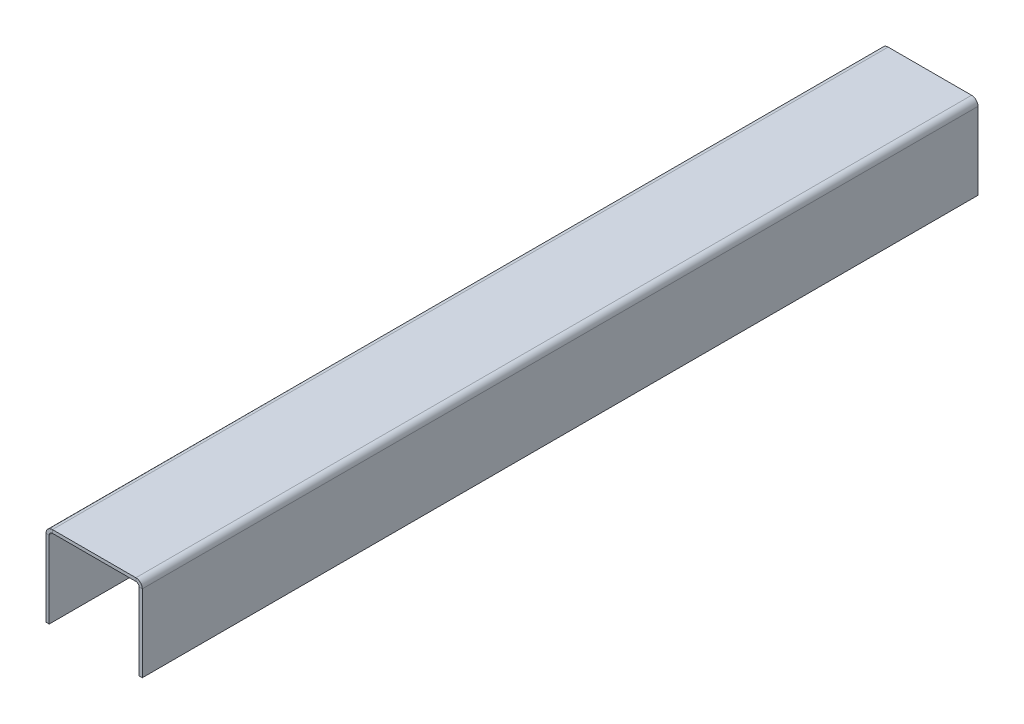
from build123d import *

# Parameters (mm, degrees)
BASE_FLANGE1_DEPTH = 826.77


# Sheet-metal steps are written as plain solids
with BuildPart() as part:
    # Sketch1 → Base-Flange1 (new body)
    with BuildSketch(Plane.XY):
        with BuildLine():
            Line((0, 0), (0, 76.2))
            ThreePointArc((0, 76.2), (1.859871939, 80.690128061), (6.35, 82.55))
            Line((6.35, 82.55), (88.9, 82.55))
            ThreePointArc((88.9, 82.55), (93.390128061, 80.690128061), (95.25, 76.2))
            Line((95.25, 76.2), (95.25, 0))
            Line((95.25, 0), (92.075, 0))
            Line((92.075, 0), (92.075, 76.2))
            ThreePointArc((92.075, 76.2), (91.14506403, 78.44506403), (88.9, 79.375))
            Line((88.9, 79.375), (6.35, 79.375))
            ThreePointArc((6.35, 79.375), (4.10493597, 78.44506403), (3.175, 76.2))
            Line((3.175, 76.2), (3.175, 0))
            Line((3.175, 0), (0, 0))
        make_face()
    extrude(amount=BASE_FLANGE1_DEPTH)


solid = part.part
